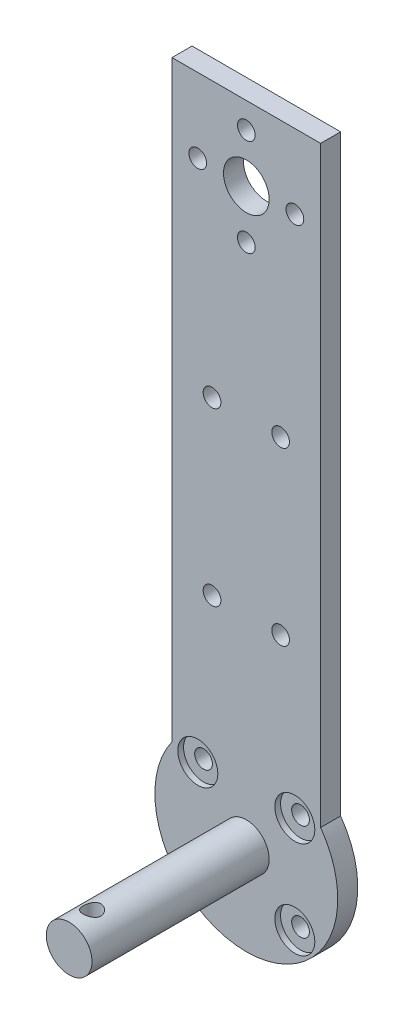
from build123d import *

# Parameters (mm, degrees)
SKETCH1_R                           = 1.55
SKETCH1_R_2                         = 4
BOSS_EXTRUDE1_DEPTH                 = 3.5
SKETCH2_R                           = 4
BOSS_EXTRUDE2_DEPTH                 = 31
SKETCH3_R                           = 3.5
CUT_EXTRUDE1_DEPTH                  = 1
CUT_EXTRUDE2_REACH                  = 121.228
CUT_EXTRUDE2_END_RADIUS             = 4
SKETCH4_R                           = 1.55
CUT_EXTRUDE2_DIRECTION_2_REACH      = 121.228
CUT_EXTRUDE2_DIRECTION_2_END_RADIUS = 4


with BuildPart() as part:
    # Sketch1 → Boss-Extrude1 (new body)
    with BuildSketch(Plane.XY):
        with BuildLine():
            Line((13, 113), (13, 9.327379053))
            ThreePointArc((13, 9.327379053), (0, -16), (-13, 9.327379053))
            Line((-13, 9.327379053), (-13, 113))
            Line((-13, 113), (13, 113))
        make_face()
        with Locations((8.485281374, 8.485281374)):
            Circle(SKETCH1_R, mode=Mode.SUBTRACT)
        with Locations((8.485281374, -8.485281374)):
            Circle(SKETCH1_R, mode=Mode.SUBTRACT)
        with Locations((-8.485281374, -8.485281374)):
            Circle(SKETCH1_R, mode=Mode.SUBTRACT)
        with Locations((-8.485281374, 8.485281374)):
            Circle(SKETCH1_R, mode=Mode.SUBTRACT)
        with Locations((0, 100)):
            Circle(SKETCH1_R_2, mode=Mode.SUBTRACT)
        with Locations((0, 108.5)):
            Circle(SKETCH1_R, mode=Mode.SUBTRACT)
        with Locations((8.5, 100)):
            Circle(SKETCH1_R, mode=Mode.SUBTRACT)
        with Locations((0, 91.5)):
            Circle(SKETCH1_R, mode=Mode.SUBTRACT)
        with Locations((-8.5, 100)):
            Circle(SKETCH1_R, mode=Mode.SUBTRACT)
        with Locations((6, 65)):
            Circle(SKETCH1_R, mode=Mode.SUBTRACT)
        with Locations((6, 35)):
            Circle(SKETCH1_R, mode=Mode.SUBTRACT)
        with Locations((-6, 65)):
            Circle(SKETCH1_R, mode=Mode.SUBTRACT)
        with Locations((-6, 35)):
            Circle(SKETCH1_R, mode=Mode.SUBTRACT)
    extrude(amount=BOSS_EXTRUDE1_DEPTH)

    # Sketch2 → Boss-Extrude2 (add)
    with BuildSketch(Plane.XY.offset(3.5)):
        Circle(SKETCH2_R)
    extrude(amount=BOSS_EXTRUDE2_DEPTH)

    # Sketch3 → Cut-Extrude1 (cut)
    with BuildSketch(Plane.XY.offset(3.5)):
        with Locations((-8.485281374, 8.485281374)):
            Circle(SKETCH3_R)
        with Locations((8.485281374, 8.485281374)):
            Circle(SKETCH3_R)
        with Locations((8.485281374, -8.485281374)):
            Circle(SKETCH3_R)
        with Locations((-8.485281374, -8.485281374)):
            Circle(SKETCH3_R)
    extrude(amount=-CUT_EXTRUDE1_DEPTH, mode=Mode.SUBTRACT)

    # Cut-Extrude2: up to this cylinder (the profile starts inside it)
    cut_extrude2_end = Plane(origin=(0, 0, 30.5), z_dir=(0, 0, -1)) * Cylinder(CUT_EXTRUDE2_END_RADIUS, 251.456, mode=Mode.PRIVATE)
    # Sketch4 → Cut-Extrude2 (cut, up to the surface)
    with BuildSketch(Plane(origin=(0, 0, 0), x_dir=(0, 0, -1), z_dir=(0, -1, 0)), mode=Mode.PRIVATE) as cut_extrude2_sk1:
        with Locations((-30.5, 0)):
            Circle(SKETCH4_R)
    cut_extrude2_tool1 = extrude(cut_extrude2_sk1.sketch, amount=-CUT_EXTRUDE2_REACH, mode=Mode.PRIVATE) & cut_extrude2_end
    add(cut_extrude2_tool1.solids().sort_by_distance((0, 0, 30.5))[0], mode=Mode.SUBTRACT)

    # Cut-Extrude2 direction 2: up to this cylinder (the profile starts inside it)
    cut_extrude2_direction_2_end = Plane(origin=(0, 0, 30.5), z_dir=(0, 0, -1)) * Cylinder(CUT_EXTRUDE2_DIRECTION_2_END_RADIUS, 251.456, mode=Mode.PRIVATE)
    # Sketch4 → Cut-Extrude2 direction 2 (cut, up to the surface)
    with BuildSketch(Plane(origin=(0, 0, 0), x_dir=(0, 0, -1), z_dir=(0, -1, 0)), mode=Mode.PRIVATE) as cut_extrude2_direction_2_sk1:
        with Locations((-30.5, 0)):
            Circle(SKETCH4_R)
    cut_extrude2_direction_2_tool1 = extrude(cut_extrude2_direction_2_sk1.sketch, amount=CUT_EXTRUDE2_DIRECTION_2_REACH, mode=Mode.PRIVATE) & cut_extrude2_direction_2_end
    add(cut_extrude2_direction_2_tool1.solids().sort_by_distance((0, 0, 30.5))[0], mode=Mode.SUBTRACT)


solid = part.part
